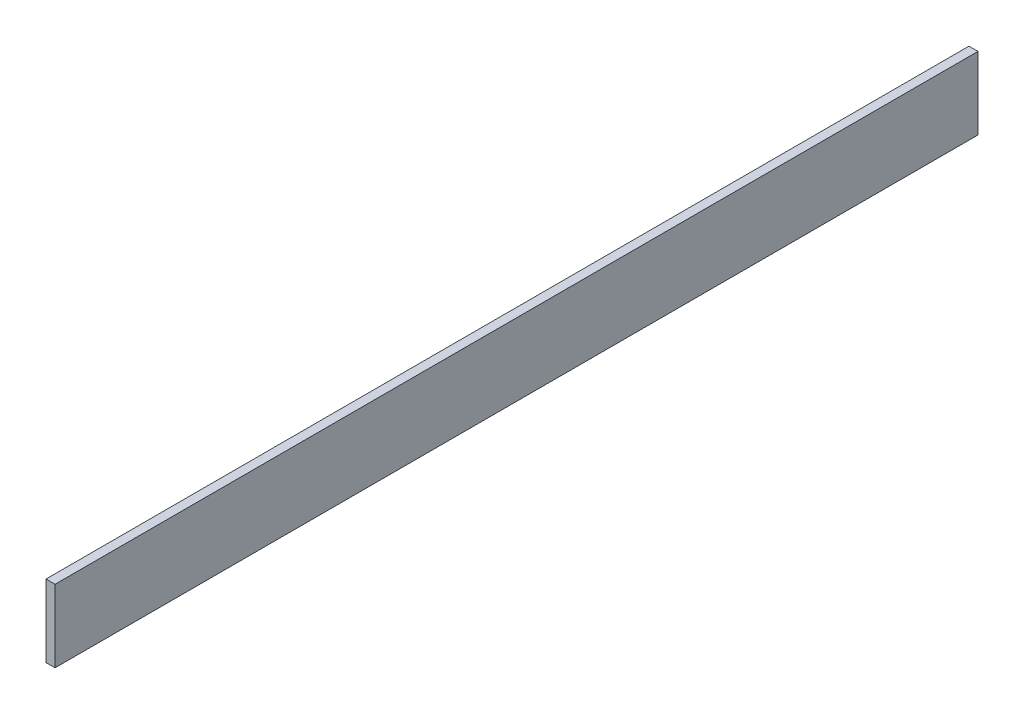
from build123d import *

# Parameters (mm, degrees)
SKETCH1_W           = 1295.4
SKETCH1_H           = 101.6
BOSS_EXTRUDE1_DEPTH = 12.7


with BuildPart() as part:
    # Sketch1 → Boss-Extrude1 (new body)
    with BuildSketch(Plane(origin=(0, 0, 0), x_dir=(0, 0, -1), z_dir=(1, 0, 0))):
        Rectangle(SKETCH1_W, SKETCH1_H)
    extrude(amount=BOSS_EXTRUDE1_DEPTH)


solid = part.part
